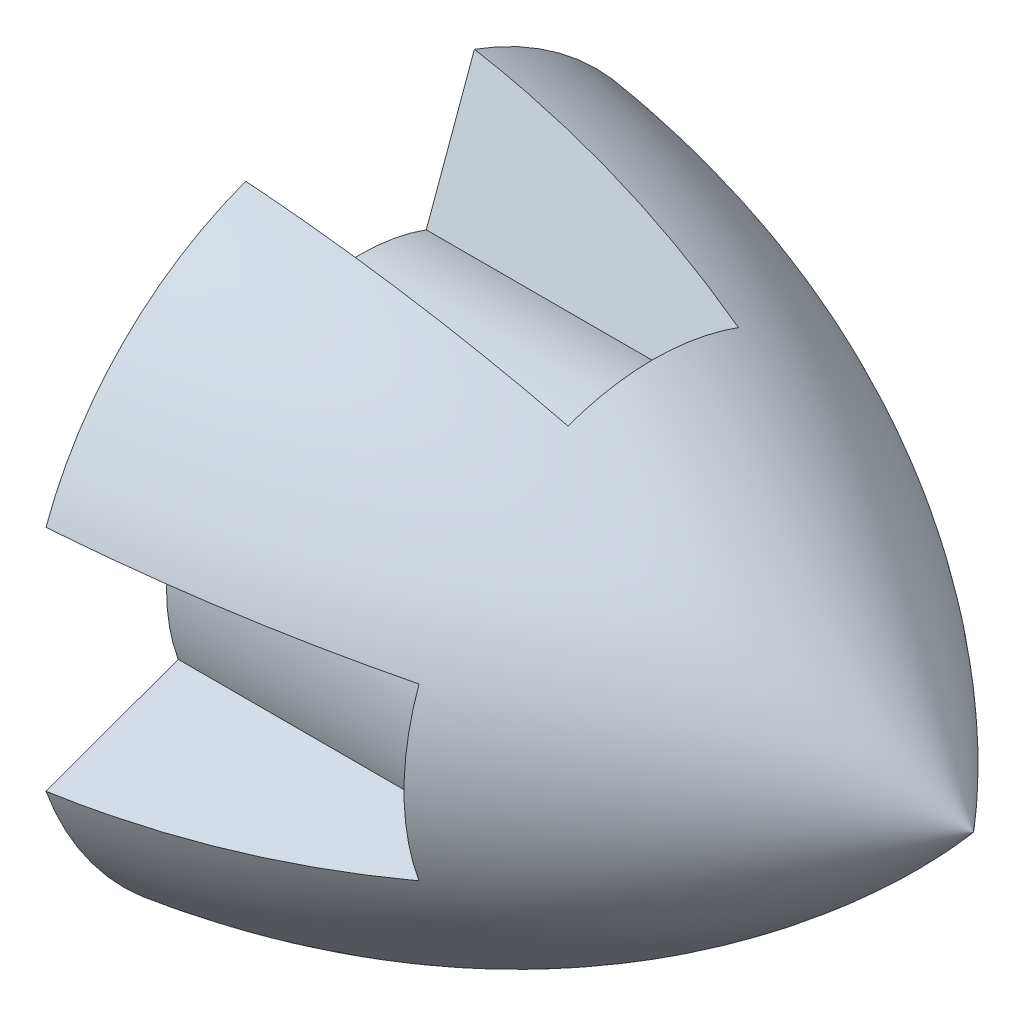
from build123d import *
from build123d.topology import SkipClean

# Parameters (mm, degrees)
SKETCH_7_R               = 12.6
CUT_EXTRUDE_1_DEPTH      = 15
SKETCH_8_R               = 16.5
CUT_EXTRUDE_2_DEPTH      = 1
CUT_EXTRUDE_3_DEPTH      = 25
PATTERN_CIRCULAR_1_COUNT = 4
EXTRUDE_START            = 1
SKETCH_12_R              = 16.5
SKETCH_12_R_2            = 12.6
EXTRUDE_1_DEPTH          = 1


with BuildPart() as part:
    # Эскиз2 → Повернуть1 (revolve)
    with BuildSketch(Plane.XY):
        with BuildLine():
            Line((0, 0), (0, 28.5))
            add(Edge.make_bspline(
                [(0, 28.5), (31.309007967, 24.448027272), (52.310724818, 0)],
                knots=[0, 0, 0, 1, 1, 1], degree=2))
            Line((52.310724818, 0), (28.5, 0))
            Line((28.5, 0), (0, 0))
        make_face()
    revolve(axis=Axis((-1000, 0, 0), (1, 0, 0)))

    # Эскиз7 → Вырез-Вытянуть1 (cut)
    with BuildSketch(Plane.ZY):
        Circle(SKETCH_7_R)
    extrude(amount=-CUT_EXTRUDE_1_DEPTH, mode=Mode.SUBTRACT)

    # Эскиз8 → Вырез-Вытянуть2 (cut)
    with BuildSketch(Plane.ZY):
        Circle(SKETCH_8_R)
    extrude(amount=-CUT_EXTRUDE_2_DEPTH, mode=Mode.SUBTRACT)

    # Эскиз11 → Вырез-Вытянуть3 (cut)
    with BuildSketch(Plane.ZY):
        with BuildLine():
            Line((-9.747574085, 26.781239692), (-5.643332365, 15.504928243))
            ThreePointArc((-5.643332365, 15.504928243), (0, 16.5), (5.643332365, 15.504928243))
            Line((5.643332365, 15.504928243), (9.747574085, 26.781239692))
            ThreePointArc((9.747574085, 26.781239692), (0, 28.5), (-9.747574085, 26.781239692))
        make_face()
    cut_extrude_3 = extrude(amount=-CUT_EXTRUDE_3_DEPTH, mode=Mode.SUBTRACT)

    # Круговой массив1: Вырез-Вытянуть3 ×4 about axis
    pattern_circular_1_axis = Axis((1, 0, 0), (-1, 0, 0))
    for i in range(1, PATTERN_CIRCULAR_1_COUNT):
        add(cut_extrude_3.rotate(pattern_circular_1_axis, i * 360 / PATTERN_CIRCULAR_1_COUNT), mode=Mode.SUBTRACT)

    # Эскиз12 → Бобышка-Вытянуть1 (add)
    with SkipClean():  # the faces are left unmerged after this step: merging them gives an invalid solid
        with BuildSketch(Plane.ZY.offset(-1).offset(EXTRUDE_START)):
            Circle(SKETCH_12_R)
            Circle(SKETCH_12_R_2, mode=Mode.SUBTRACT)
        extrude(amount=-EXTRUDE_1_DEPTH)


solid = part.part
